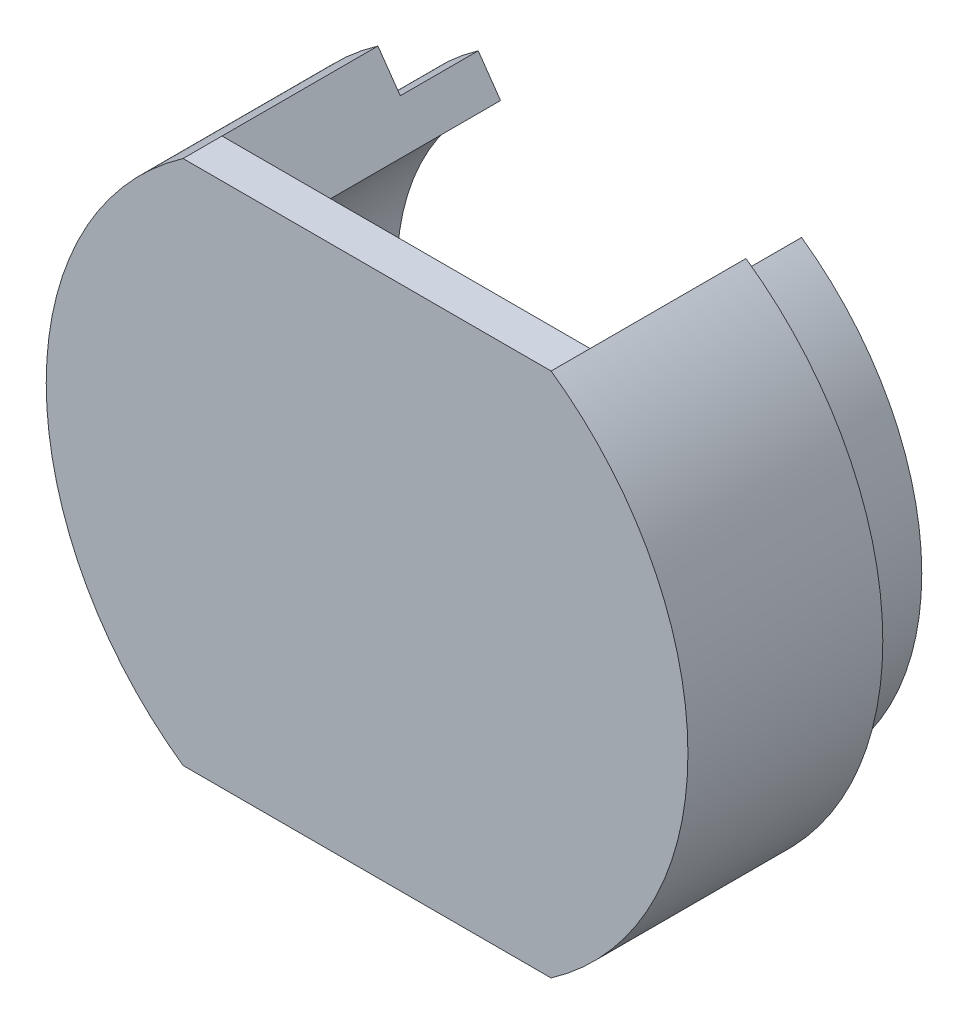
from build123d import *
from build123d.topology import SkipClean

# Parameters (mm, degrees)
SKETCH1_R           = 36.16223967
SKETCH1_R_2         = 31.16223967
BOSS_EXTRUDE1_DEPTH = 5
CUT_EXTRUDE1_DEPTH  = 52.384970136
BOSS_EXTRUDE2_DEPTH = 20
BOSS_EXTRUDE3_DEPTH = 5


with BuildPart() as part:
    # Sketch1 → Boss-Extrude1 (new, symmetric)
    with BuildSketch(Plane.XY):
        Circle(SKETCH1_R)
        Circle(SKETCH1_R_2, mode=Mode.SUBTRACT)
    extrude(amount=BOSS_EXTRUDE1_DEPTH, both=True)

    # Sketch2 → Cut-Extrude1 (cut, symmetric)
    with BuildSketch(Plane.XY):
        with BuildLine():
            Line((20.74180856, 29.622372552), (17.873926379, 25.52661233))
            ThreePointArc((17.873926379, 25.52661233), (0, 31.16223967), (-17.873926379, 25.52661233))
            Line((-17.873926379, 25.52661233), (-20.74180856, 29.622372552))
            ThreePointArc((-20.74180856, 29.622372552), (0, 36.16223967), (20.74180856, 29.622372552))
        make_face()
    cut_extrude1 = extrude(amount=CUT_EXTRUDE1_DEPTH, both=True, mode=Mode.SUBTRACT)

    # Mirror1: Cut-Extrude1 across plane
    add(cut_extrude1.mirror(Plane.ZX), mode=Mode.SUBTRACT)

    # Sketch3 → Boss-Extrude2 (add)
    with SkipClean():  # the faces are left unmerged after this step: merging them gives an invalid solid
        with BuildSketch(Plane.XY.offset(5)):
            with BuildLine():
                Line((-17.873926379, 25.52661233), (-23.609690742, 33.718132773))
                ThreePointArc((-23.609690742, 33.718132773), (-41.16223967, 0), (-23.609690742, -33.718132773))
                Line((-23.609690742, -33.718132773), (-17.873926379, -25.52661233))
                ThreePointArc((-17.873926379, -25.52661233), (-31.16223967, 0), (-17.873926379, 25.52661233))
            make_face()
            with BuildLine():
                Line((17.873926379, -25.52661233), (23.609690742, -33.718132773))
                ThreePointArc((23.609690742, -33.718132773), (41.16223967, 0), (23.609690742, 33.718132773))
                Line((23.609690742, 33.718132773), (17.873926379, 25.52661233))
                ThreePointArc((17.873926379, 25.52661233), (31.16223967, 0), (17.873926379, -25.52661233))
            make_face()
        extrude(amount=BOSS_EXTRUDE2_DEPTH)

    # Sketch4 → Boss-Extrude3 (add)
    with SkipClean():  # the faces are left unmerged after this step: merging them gives an invalid solid
        with BuildSketch(Plane.XY.offset(25)):
            with BuildLine():
                Line((23.609690742, 33.718132773), (-23.609690742, 33.718132773))
                ThreePointArc((-23.609690742, 33.718132773), (-41.16223967, 0), (-23.609690742, -33.718132773))
                Line((-23.609690742, -33.718132773), (23.609690742, -33.718132773))
                ThreePointArc((23.609690742, -33.718132773), (41.16223967, 0), (23.609690742, 33.718132773))
            make_face()
        extrude(amount=BOSS_EXTRUDE3_DEPTH)


solid = part.part
